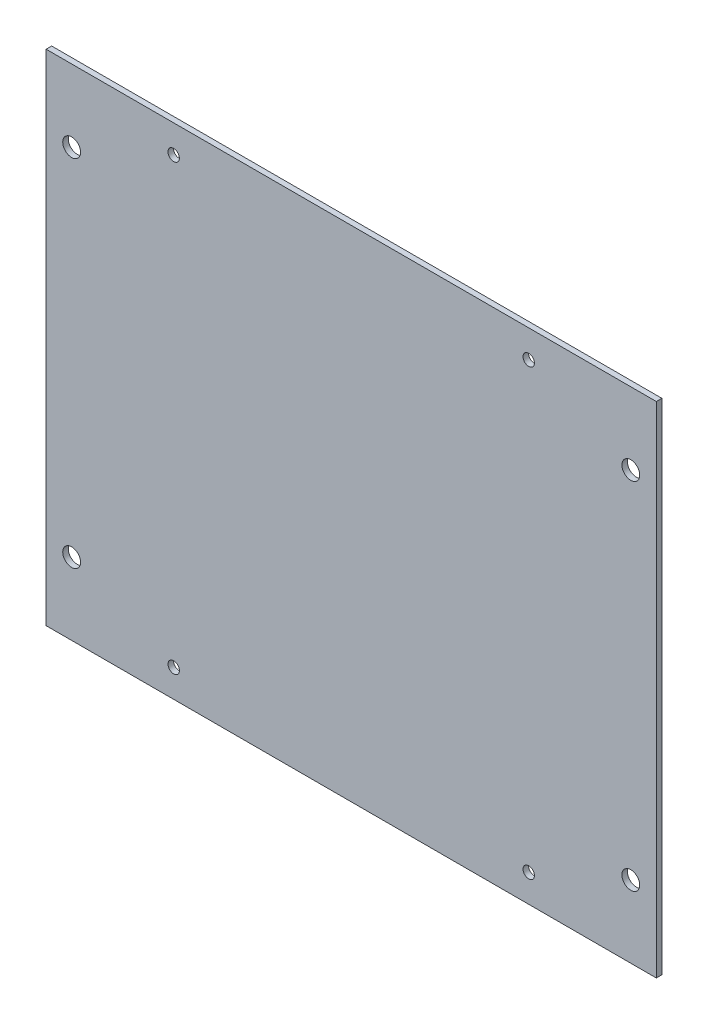
from build123d import *

# Parameters (mm, degrees)
SKETCH3_W              = 914.4
SKETCH3_H              = 609.6
BOSS_EXTRUDE1_DEPTH    = 0.79375
SKETCH4_OUTSIDE_W      = 1136.194
SKETCH4_OUTSIDE_H      = 831.394
CUT_EXTRUDE1_DEPTH     = 2.54
F_4_CLEARANCE_HOLE1_D  = 3.2639
F_10_CLEARANCE_HOLE1_D = 5.1054


with BuildPart() as part:
    # Sketch3 → Boss-Extrude1 (new, symmetric)
    with BuildSketch(Plane.XY):
        Rectangle(SKETCH3_W, SKETCH3_H)
    extrude(amount=BOSS_EXTRUDE1_DEPTH, both=True)

    # Sketch4 outside → Cut-Extrude1 (cut)
    with BuildSketch(Plane(origin=(0, 0, -0.79375), x_dir=(-1, 0, 0), z_dir=(0, 0, -1))):
        Rectangle(SKETCH4_OUTSIDE_W, SKETCH4_OUTSIDE_H)
        Polygon((406.259707027, -70.252637804), (231.634706477, -70.252637804), (231.634706477, 72.622362196), (406.25970701, 72.622362196), align=None, mode=Mode.SUBTRACT)
    extrude(amount=-CUT_EXTRUDE1_DEPTH, mode=Mode.SUBTRACT)

    # #4 Clearance Hole1 (through all)
    with Locations(Plane(origin=(0, 0, -0.79375), x_dir=(-1, 0, 0), z_dir=(0, 0, -1))):
        with Locations((268.147206747, -62.315137804), (369.765534747, 64.659462196), (369.747206747, -62.315137804), (268.147206747, 64.684862196)):
            Hole(F_4_CLEARANCE_HOLE1_D / 2)

    # #10 Clearance Hole1 (through all)
    with Locations(Plane(origin=(0, 0, -0.79375), x_dir=(-1, 0, 0), z_dir=(0, 0, -1))):
        with Locations((238.937206477, -49.615138312), (238.937206477, 51.984562202), (398.957207012, 51.984862703), (398.957207024, -49.614837811)):
            Hole(F_10_CLEARANCE_HOLE1_D / 2)


solid = part.part
